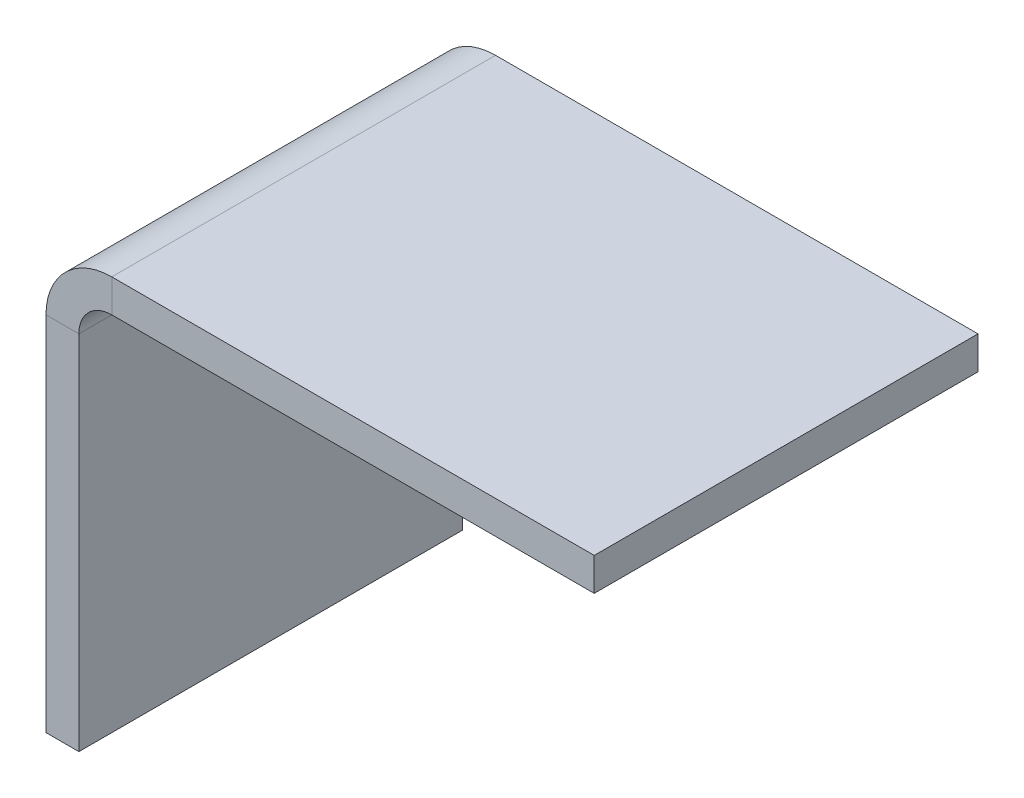
from build123d import *

# Parameters (mm, degrees)
SKETCH1_W          = 35
SKETCH1_H          = 33
BASE_FLANGE1_DEPTH = 3
EDGE_FLANGE1_DEPTH = 35


# Sheet-metal steps are written as plain solids
with BuildPart() as part:
    # Sketch1 → Base-Flange1 (new body)
    with BuildSketch(Plane(origin=(0, 0, 0), x_dir=(0, 0, -1), z_dir=(1, 0, 0))):
        with Locations((-1713.733243968, 358.835120643)):
            Rectangle(SKETCH1_W, SKETCH1_H)
    extrude(amount=-BASE_FLANGE1_DEPTH)

    # Edge-Flange1 section (across the edge) → Edge-Flange1 (add)
    with BuildSketch(Plane(origin=(0, 378.335120643, 1696.233243968), x_dir=(0, -1, 0), z_dir=(0, 0, 1))):
        with BuildLine():
            Line((-3, 3), (-3, 47))
            Line((-3, 47), (0, 47))
            Line((0, 47), (0, 3))
            ThreePointArc((0, 3), (0.878679656, 0.878679656), (3, 0))
            Line((3, 0), (3, -3))
            ThreePointArc((3, -3), (-1.242640687, -1.242640687), (-3, 3))
        make_face()
    extrude(amount=EDGE_FLANGE1_DEPTH)


solid = part.part
